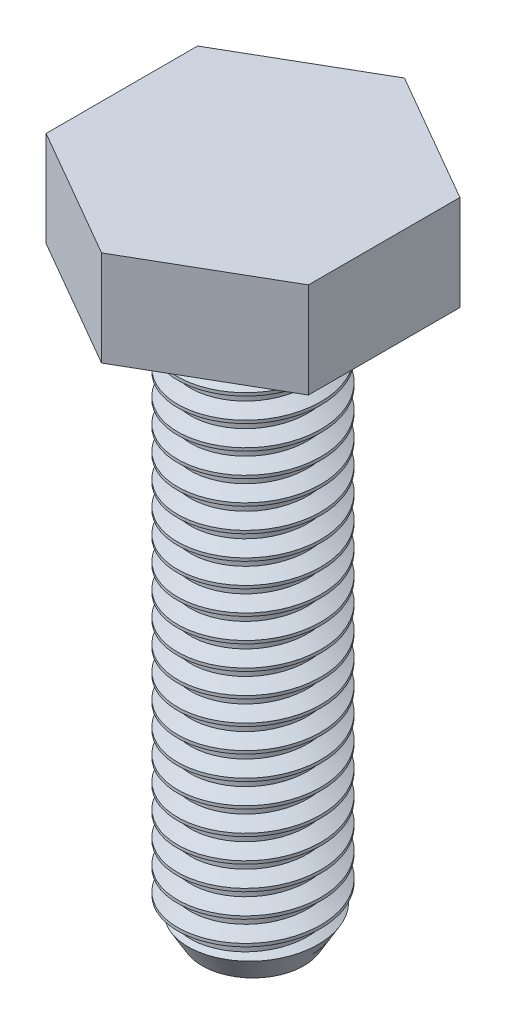
from build123d import *

# Parameters (mm, degrees)
BOSS_EXTRUDE1_DEPTH = 2
THREAD1_PITCH       = 0.5


with BuildPart() as part:
    # Sketch1 → Revolve1 (revolve)
    with BuildSketch(Plane.XY, mode=Mode.PRIVATE) as revolve1_sk:
        Polygon((0, 14), (2.75, 14), (2.75, 12), (1.5, 12), (1.5, 0.75), (1.066987298, 0), (0, 0), align=None)
    revolve(revolve1_sk.sketch.rotate(Axis((0, 0, 0), (0, 1, 0)), 90), axis=Axis((0, 0, 0), (0, 1, 0)))

    # Sketch2 → Boss-Extrude1 (add)
    with BuildSketch(Plane(origin=(0, 14, 0), x_dir=(1, 0, 0), z_dir=(0, 1, 0))):
        Polygon((0, 3.175426481), (-2.75, 1.58771324), (-2.75, -1.58771324), (0, -3.175426481), (2.75, -1.58771324), (2.75, 1.58771324), align=None)
    extrude(amount=-BOSS_EXTRUDE1_DEPTH)

    # Thread1: arcs per turn and ends read off the stored shape
    # Thread1: the profile of Thread Profile1 profile screwed along a right-hand helix through 22 turns, 6 arcs to a turn; built about Z, then put on its axis
    thread1_z = Axis((0, 0, 0), (0, 0, 1))
    thread1_corners = [(1.5003, 0, -0.000173205), (1.5003, 0, 0.437673204), (1.229367062, 0, 0.281249999), (1.229367062, 0, 0.156249999)]
    with BuildLine(mode=Mode.PRIVATE) as thread1_profile:
        Line(thread1_corners[0], thread1_corners[1])
        Line(thread1_corners[1], thread1_corners[2])
        Line(thread1_corners[2], thread1_corners[3])
        Line(thread1_corners[3], thread1_corners[0])
    thread1_cap = Face(thread1_profile.wire())
    thread1_turn_angles = [0, 30, 60, 90, 120, 150, 180, 210, 240, 270, 300, 330, 360]
    thread1_turn_weights = [1, 0.8660254037844387, 1, 0.8660254037844387, 1, 0.8660254037844387, 1, 0.8660254037844387, 1, 0.8660254037844387, 1, 0.8660254037844387, 1]
    thread1_turn_rails = [Edge.make_bspline([Vector(p[0], p[1], 0).rotate(thread1_z, thread1_turn_angles[k]) / thread1_turn_weights[k] + Vector(0, 0, p[2] + THREAD1_PITCH * thread1_turn_angles[k] / 360) for k in range(13)], [0, 0, 0, 1, 1, 2, 2, 3, 3, 4, 4, 5, 5, 6, 6, 6], 2, thread1_turn_weights) for p in thread1_corners]
    thread1_turn_sides = [Face.make_surface_from_curves(thread1_turn_rails[p[0]], thread1_turn_rails[p[1]]) for p in [(0, 1), (1, 2), (2, 3), (3, 0)]]
    thread1 = Plane(origin=(0, 0, 0), x_dir=(1, 0, 0), z_dir=(0, 1, 0)) * Solid(Shell([*[p.moved(Location((0, 0, THREAD1_PITCH * i))) for i in range(22) for p in thread1_turn_sides], thread1_cap, thread1_cap.rotate(thread1_z, 7920).moved(Location((0, 0, THREAD1_PITCH * 7920 / 360)))]))
    add(thread1, mode=Mode.SUBTRACT)


solid = part.part
